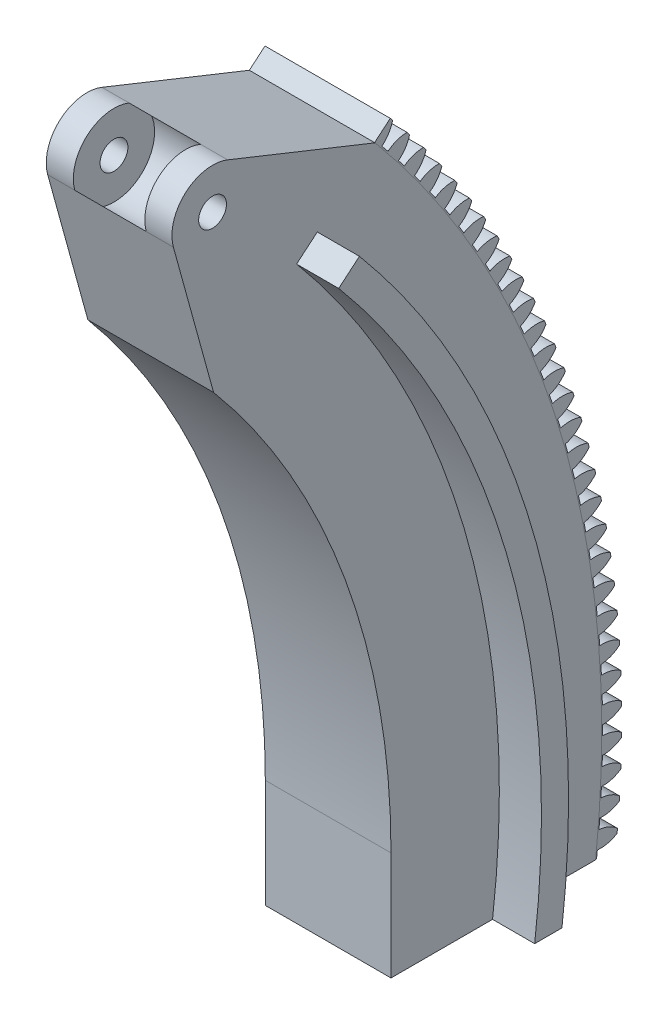
from build123d import *

# Parameters (mm, degrees)
BOSS_EXTRUDE2_DEPTH     = 6.35
BOSS_EXTRUDE3_DEPTH     = 29.464
CUT_EXTRUDE4_DEPTH      = 6.35
CIRPATTERN3_COUNT       = 230
CUT_EXTRUDE7_DEPTH      = 284.05774535
CUT_EXTRUDE7_DEPTH_BACK = 284.05774535
SKETCH15_R              = 3.2639
BOSS_EXTRUDE4_DEPTH     = 9.87425
BOSS_EXTRUDE6_START     = 23.01875
BOSS_EXTRUDE6_DEPTH     = 23.01875
SKETCH28_R              = 9.525
CUT_EXTRUDE8_DEPTH      = 16.764
SKETCH29_R              = 3.175
CUT_EXTRUDE9_DEPTH      = 12.7


with BuildPart() as part:
    # Sketch11 → Boss-Extrude2 (new body)
    with BuildSketch(Plane(origin=(6.35, 0, 0), x_dir=(0, 0, -1), z_dir=(1, 0, 0))):
        with BuildLine():
            Line((177.722316491, 149.126730219), (155.660230842, 130.614442288))
            ThreePointArc((155.660230842, 130.614442288), (190.945540544, 69.498493124), (203.2, 0))
            ThreePointArc((203.2, 0), (202.801171077, -12.724975829), (201.606249903, -25.4))
            Line((201.606249903, -25.4), (230.605384683, -25.4))
            ThreePointArc((230.605384683, -25.4), (231.65108936, -12.719129025), (232.000007424, 0))
            ThreePointArc((232.000007424, 0), (218.008694999, 79.348675791), (177.722316491, 149.126730219))
        make_face()
    extrude(amount=-BOSS_EXTRUDE2_DEPTH)

    # Sketch1 → Boss-Extrude3 (add)
    with BuildSketch(Plane(origin=(0, 0, 0), x_dir=(0, 0, -1), z_dir=(1, 0, 0))):
        with BuildLine():
            Line((177.8, 0), (177.8, -25.4))
            Line((177.8, -25.4), (225.775729431, -25.4))
            ThreePointArc((225.775729431, -25.4), (226.843652905, -12.71995034), (227.2, 0))
            ThreePointArc((227.2, 0), (213.498163443, 77.706976564), (174.045297477, 146.041344921))
            Line((174.045297477, 146.041344921), (139.503343029, 159.851365822))
            ThreePointArc((139.503343029, 159.851365822), (129.618020291, 158.107153482), (126.784391338, 148.47738561))
            Line((126.784391338, 148.47738561), (136.202701987, 114.287637002))
            ThreePointArc((136.202701987, 114.287637002), (167.077347976, 60.811181483), (177.8, 0))
        make_face()
    extrude(amount=BOSS_EXTRUDE3_DEPTH)

    # Sketch12 → Cut-Extrude4 (cut)
    with BuildSketch(Plane(origin=(6.35, 0, 0), x_dir=(0, 0, -1), z_dir=(1, 0, 0))):
        with BuildLine():
            ThreePointArc((227.497230324, 1.124058456), (230.494867292, 1.773780404), (232.972473, 3.581938572))
            ThreePointArc((232.972473, 3.581938572), (233.000007424, 0), (232.972473, -3.581938572))
            ThreePointArc((232.972473, -3.581938572), (230.494867292, -1.773780404), (227.497230324, -1.124058456))
            ThreePointArc((227.497230324, -1.124058456), (227.50000728, 0), (227.497230324, 1.124058456))
        make_face()
    cut_extrude4 = extrude(amount=-CUT_EXTRUDE4_DEPTH, mode=Mode.SUBTRACT)

    # CirPattern3: Cut-Extrude4 ×230 about axis
    cirpattern3_axis = Axis((0, 0, 0), (1, 0, 0))
    for i in range(1, CIRPATTERN3_COUNT):
        add(cut_extrude4.rotate(cirpattern3_axis, i * 360 / CIRPATTERN3_COUNT), mode=Mode.SUBTRACT)

    # Sketch15 → Cut-Extrude7 (cut, two sides: drawn at the far end of the back side and taken through both)
    with BuildSketch(Plane(origin=(6.35, 0, 0), x_dir=(0, 0, -1), z_dir=(1, 0, 0)).offset(-CUT_EXTRUDE7_DEPTH_BACK)):
        with Locations((135.967339212, 151.007028537)):
            Circle(SKETCH15_R)
    extrude(amount=CUT_EXTRUDE7_DEPTH + CUT_EXTRUDE7_DEPTH_BACK, mode=Mode.SUBTRACT)

    # Sketch23 → Boss-Extrude4 (add)
    with BuildSketch(Plane(origin=(0, 0, 0), x_dir=(0, 0, -1), z_dir=(1, 0, 0))):
        with BuildLine():
            Line((155.660230842, 130.614442288), (160.524613056, 134.69614361))
            ThreePointArc((160.524613056, 134.69614361), (196.912588686, 71.670321034), (209.55, 0))
            ThreePointArc((209.55, 0), (209.163370775, -12.723475387), (208.004909798, -25.4))
            Line((208.004909798, -25.4), (201.606249903, -25.4))
            ThreePointArc((201.606249903, -25.4), (202.801171077, -12.724975829), (203.2, 0))
            ThreePointArc((203.2, 0), (190.945540544, 69.498493124), (155.660230842, 130.614442288))
        make_face()
    boss_extrude4 = extrude(amount=-BOSS_EXTRUDE4_DEPTH)

    # Mirror2: Boss-Extrude4 across plane
    add(boss_extrude4.mirror(Plane(origin=(14.732, 0, 0), x_dir=(0, 0, 1), z_dir=(1, 0, 0))))

    # Sketch27 → Boss-Extrude6 (add)
    with BuildSketch(Plane(origin=(6.35, 0, 0), x_dir=(0, 0, -1), z_dir=(1, 0, 0)).offset(BOSS_EXTRUDE6_START)):
        with BuildLine():
            Line((177.722316491, 149.126730219), (174.045297477, 146.041344921))
            ThreePointArc((174.045297477, 146.041344921), (217.513785946, 65.632255207), (225.775729431, -25.4))
            Line((225.775729431, -25.4), (226.07762674, -25.4))
            ThreePointArc((226.07762674, -25.4), (226.171897735, -24.546404775), (226.262945845, -23.692459772))
            ThreePointArc((226.262945845, -23.692459772), (228.663101283, -23.551544215), (230.891757831, -22.649494707))
            ThreePointArc((230.891757831, -22.649494707), (230.94034564, -22.148593645), (230.987846786, -21.647588364))
            ThreePointArc((230.987846786, -21.647588364), (228.971262049, -20.338394215), (226.641640358, -19.743864063))
            ThreePointArc((226.641640358, -19.743864063), (226.736426656, -18.623805724), (226.825677683, -17.503292725))
            ThreePointArc((226.825677683, -17.503292725), (229.221088498, -17.296869983), (231.424274191, -16.33428174))
            ThreePointArc((231.424274191, -16.33428174), (231.459161859, -15.832240407), (231.492960423, -15.330124577))
            ThreePointArc((231.492960423, -15.330124577), (229.441367736, -14.07650152), (227.096375799, -13.545826347))
            ThreePointArc((227.096375799, -13.545826347), (227.160532561, -12.423596854), (227.219143699, -11.301064066))
            ThreePointArc((227.219143699, -11.301064066), (229.608022346, -11.029288179), (231.784093084, -10.006879521))
            ThreePointArc((231.784093084, -10.006879521), (231.805254577, -9.504072559), (231.825325337, -9.001220877))
            ThreePointArc((231.825325337, -9.001220877), (229.740255675, -7.804104412), (227.381643413, -7.337680228))
            ThreePointArc((227.381643413, -7.337680228), (227.415122764, -6.21411703), (227.443050275, -5.090402129))
            ThreePointArc((227.443050275, -5.090402129), (229.823614083, -4.753475906), (231.970946001, -3.672009792))
            ThreePointArc((231.970946001, -3.672009792), (231.978365527, -3.168812415), (231.984693505, -2.665600128))
            ThreePointArc((231.984693505, -2.665600128), (229.867702826, -1.525883589), (227.497230324, -1.124058456))
            ThreePointArc((227.497230324, -1.124058456), (227.50000728, 0), (227.497230324, 1.124058456))
            ThreePointArc((227.497230324, 1.124058456), (229.867702826, 1.525883589), (231.984693505, 2.665600128))
            ThreePointArc((231.984693505, 2.665600128), (231.978365527, 3.168812415), (231.970946001, 3.672009792))
            ThreePointArc((231.970946001, 3.672009792), (229.823614083, 4.753475906), (227.443050275, 5.090402129))
            ThreePointArc((227.443050275, 5.090402129), (227.415122764, 6.21411703), (227.381643413, 7.337680228))
            ThreePointArc((227.381643413, 7.337680228), (229.740255675, 7.804104412), (231.825325337, 9.001220877))
            ThreePointArc((231.825325337, 9.001220877), (231.805254577, 9.504072559), (231.784093084, 10.006879521))
            ThreePointArc((231.784093084, 10.006879521), (229.608022346, 11.029288179), (227.219143699, 11.301064066))
            ThreePointArc((227.219143699, 11.301064066), (227.160532561, 12.423596854), (227.096375799, 13.545826347))
            ThreePointArc((227.096375799, 13.545826347), (229.441367736, 14.07650152), (231.492960423, 15.330124577))
            ThreePointArc((231.492960423, 15.330124577), (231.459161859, 15.832240407), (231.424274191, 16.33428174))
            ThreePointArc((231.424274191, 16.33428174), (229.221088498, 17.296869983), (226.825677683, 17.503292725))
            ThreePointArc((226.825677683, 17.503292725), (226.736426656, 18.623805724), (226.641640358, 19.743864063))
            ThreePointArc((226.641640358, 19.743864063), (228.971262049, 20.338394215), (230.987846786, 21.647588364))
            ThreePointArc((230.987846786, 21.647588364), (230.94034564, 22.148593645), (230.891757831, 22.649494707))
            ThreePointArc((230.891757831, 22.649494707), (228.663101283, 23.551544215), (226.262945845, 23.692459772))
            ThreePointArc((226.262945845, 23.692459772), (226.143121532, 24.810116812), (226.017776432, 25.927168167))
            ThreePointArc((226.017776432, 25.927168167), (228.330289425, 26.585109638), (230.310361361, 27.94889791))
            ThreePointArc((230.310361361, 27.94889791), (230.24919308, 28.448418771), (230.186941388, 28.947805772))
            ThreePointArc((230.186941388, 28.947805772), (227.934477093, 29.788643403), (225.531368117, 29.863946617))
            ThreePointArc((225.531368117, 29.863946617), (225.381059935, 30.977913661), (225.225249571, 32.091124447))
            ThreePointArc((225.225249571, 32.091124447), (227.518928183, 32.811986256), (229.461009714, 34.22935094))
            ThreePointArc((229.461009714, 34.22935094), (229.386219944, 34.727014622), (229.310350824, 35.2245149))
            ThreePointArc((229.310350824, 35.2245149), (227.035759654, 36.003513188), (224.631490431, 36.013147865))
            ThreePointArc((224.631490431, 36.013147865), (224.450810546, 37.12259363), (224.264651187, 38.231133128))
            ThreePointArc((224.264651187, 38.231133128), (226.537783789, 39.01437734), (228.440425662, 40.484260746))
            ThreePointArc((228.440425662, 40.484260746), (228.352070214, 40.979695873), (228.262640281, 41.474938174))
            ThreePointArc((228.262640281, 41.474938174), (225.967619622, 42.191515802), (223.563984308, 42.135474753))
            ThreePointArc((223.563984308, 42.135474753), (223.353067549, 43.239571328), (223.136698117, 44.342612304))
            ThreePointArc((223.136698117, 44.342612304), (225.387588412, 45.187654434), (227.249370803, 46.70895968))
            ThreePointArc((227.249370803, 46.70895968), (227.147515611, 47.201796539), (227.044591603, 47.694411295))
            ThreePointArc((227.044591603, 47.694411295), (224.730854085, 48.348033526), (222.329646362, 48.226358571))
            ThreePointArc((222.329646362, 48.226358571), (222.088650124, 49.324282038), (221.84223208, 50.421001361))
            ThreePointArc((221.84223208, 50.421001361), (224.06920037, 51.327210806), (225.888733947, 52.898802637))
            ThreePointArc((225.888733947, 52.898802637), (225.773455019, 53.388673455), (225.657113741, 53.878293059))
            ThreePointArc((225.657113741, 53.878293059), (223.326385962, 54.468472135), (220.929397701, 54.281254073))
            ThreePointArc((220.929397701, 54.281254073), (220.658501825, 55.37218512), (220.382219056, 56.461764377))
            ThreePointArc((220.382219056, 56.461764377), (222.583603493, 57.428464891), (224.359530453, 59.049170525))
            ThreePointArc((224.359530453, 59.049170525), (224.230913815, 59.535709743), (224.101242084, 60.021968822))
            ThreePointArc((224.101242084, 60.021968822), (221.75526332, 60.54826433), (219.364283245, 60.295642869))
            ThreePointArc((219.364283245, 60.295642869), (219.063689882, 61.378767402), (218.75774856, 62.460393508))
            ThreePointArc((218.75774856, 62.460393508), (220.931906389, 63.486863702), (222.662901469, 65.15547371))
            ThreePointArc((222.662901469, 65.15547371), (222.521043099, 65.638318252), (222.378137682, 66.120853942))
            ThreePointArc((222.378137682, 66.120853942), (220.01865859, 66.58287314), (217.635470939, 66.265036796))
            ThreePointArc((217.635470939, 66.265036796), (217.305404404, 67.339546548), (216.970032835, 68.412412353))
            ThreePointArc((216.970032835, 68.412412353), (219.115341617, 69.497886237), (220.800113083, 71.213155438))
            ThreePointArc((220.800113083, 71.213155438), (220.645118841, 71.691944989), (220.489086379, 72.170397203))
            ThreePointArc((220.489086379, 72.170397203), (218.117867692, 72.567795315), (215.744250889, 72.18498127))
            ThreePointArc((215.744250889, 72.18498127), (215.384957489, 73.250074401), (215.02040594, 74.313379293))
            ThreePointArc((215.02040594, 74.313379293), (217.135264766, 75.457046844), (218.772555378, 77.21769524))
            ThreePointArc((218.772555378, 77.21769524), (218.604540927, 77.69207251), (218.435497858, 78.166084208))
            ThreePointArc((218.435497858, 78.166084208), (216.054309067, 78.498564682), (213.692034393, 78.051058605))
            ThreePointArc((213.692034393, 78.051058605), (213.303782248, 79.105940303), (212.91032276, 80.158890803))
            ThreePointArc((212.91032276, 80.158890803), (214.993153443, 81.359898575), (216.581741393, 83.164612305))
            ThreePointArc((216.581741393, 83.164612305), (216.400832112, 83.634223294), (216.218904581, 84.103440753))
            ThreePointArc((216.218904581, 84.103440753), (213.829522619, 84.370755478), (211.480352893, 83.858891315))
            ThreePointArc((211.480352893, 83.858891315), (211.06343173, 84.902774388), (210.641357917, 85.944584746))
            ThreePointArc((210.641357917, 85.944584746), (212.690606171, 87.202036501), (214.229305997, 89.049468819))
            ThreePointArc((214.229305997, 89.049468819), (214.035636886, 89.513963087), (213.840960655, 89.978036158))
            ThreePointArc((213.840960655, 89.978036158), (211.445168568, 90.179985654), (209.110856828, 89.604145378))
            ThreePointArc((209.110856828, 89.604145378), (208.66557777, 90.63625084), (208.2152046, 91.666143618))
            ThreePointArc((208.2152046, 91.666143618), (210.229341199, 92.979100999), (211.717004663, 94.867873282))
            ThreePointArc((211.717004663, 94.867873282), (211.510720247, 95.326904206), (211.30344059, 95.78548658))
            ThreePointArc((211.30344059, 95.78548658), (208.903026208, 95.921920145), (206.585314405, 95.28253347))
            ThreePointArc((206.585314405, 95.28253347), (206.112009735, 96.302091126), (205.633673294, 97.319297778))
            ThreePointArc((205.633673294, 97.319297778), (207.611195213, 98.686781007), (209.046712167, 100.615483783))
            ThreePointArc((209.046712167, 100.615483783), (208.827966381, 101.068708817), (208.608237979, 101.521458283))
            ThreePointArc((208.608237979, 101.521458283), (206.204992582, 101.592274105), (203.905610279, 100.889818164))
            ThreePointArc((203.905610279, 100.889818164), (203.404633195, 101.896067182), (202.898690434, 102.899828632))
            ThreePointArc((202.898690434, 102.899828632), (204.838121973, 104.320817242), (206.220421179, 106.28801124))
            ThreePointArc((206.220421179, 106.28801124), (205.989377261, 106.735092169), (205.757364083, 107.181670869))
            ThreePointArc((205.757364083, 107.181670869), (203.353081061, 107.186816103), (201.073744144, 106.421815095))
            ThreePointArc((201.073744144, 106.421815095), (200.545468495, 107.414004574), (200.012296968, 108.403571777))
            ThreePointArc((200.012296968, 108.403571777), (201.91219085, 109.877005372), (203.240240785, 111.881222599))
            ThreePointArc((203.240240785, 111.881222599), (202.997071148, 112.321825796), (202.752946331, 112.761900475))
            ThreePointArc((202.752946331, 112.761900475), (200.349419851, 112.701371281), (198.091829247, 111.874396079))
            ThreePointArc((198.091829247, 111.874396079), (197.53664925, 112.851785611), (196.97664683, 113.826420114))
            ThreePointArc((196.97664683, 113.826420114), (198.835585283, 115.351199164), (200.108394907, 117.390943997))
            ThreePointArc((200.108394907, 117.390943997), (199.853281013, 117.824740666), (199.597226732, 118.257982925))
            ThreePointArc((199.597226732, 118.257982925), (197.196250396, 118.131824473), (194.962090802, 117.243492197))
            ThreePointArc((194.962090802, 117.243492197), (194.380420754, 118.205352416), (193.794005336, 119.164326911))
            ThreePointArc((193.794005336, 119.164326911), (195.610601151, 120.739313568), (196.827220645, 122.813063873))
            ThreePointArc((196.827220645, 122.813063873), (196.56035287, 123.2397303), (196.292560202, 123.665816837))
            ThreePointArc((196.292560202, 123.665816837), (193.895925708, 123.47412327), (191.686864339, 122.525096826))
            ThreePointArc((191.686864339, 122.525096826), (191.079138305, 123.470709957), (190.466747493, 124.413308821))
            ThreePointArc((190.466747493, 124.413308821), (192.239645057, 126.037327771), (193.399166535, 128.143536038))
            ThreePointArc((193.399166535, 128.143536038), (193.120744025, 128.562753829), (192.841412808, 128.981366682))
            ThreePointArc((192.841412808, 128.981366682), (190.450908614, 128.724281049), (188.268593954, 127.715268637))
            ThreePointArc((188.268593954, 127.715268637), (187.635265441, 128.643929027), (186.997356225, 129.569448858))
            ThreePointArc((186.997356225, 129.569448858), (188.725232536, 131.241288196), (189.826790719, 133.378382695))
            ThreePointArc((189.826790719, 133.378382695), (189.537021244, 133.789839012), (189.246359924, 134.200665797))
            ThreePointArc((189.246359924, 134.200665797), (186.863769915, 133.878379945), (184.709830489, 132.810134528))
            ThreePointArc((184.709830489, 132.810134528), (184.05137211, 133.721149176), (183.388420522, 134.628899316))
            ThreePointArc((183.388420522, 134.628899316), (185.069986174, 136.347311455), (186.112759037, 138.513697403))
            ThreePointArc((186.112759037, 138.513697403), (185.811858834, 138.917085204), (185.510084314, 139.319819345))
            ThreePointArc((185.510084314, 139.319819345), (183.137186467, 138.932573777), (181.013229625, 137.805892519))
            ThreePointArc((181.013229625, 137.805892519), (180.330132748, 138.698581592), (179.642633506, 139.587884644))
            ThreePointArc((179.642633506, 139.587884644), (181.276633653, 141.351587239), (182.25984304, 143.545648))
            ThreePointArc((182.25984304, 143.545648), (181.948036652, 143.94066626), (181.635374127, 144.335007224))
            ThreePointArc((181.635374127, 144.335007224), (179.273939188, 143.883090915), (177.181549907, 142.698814589))
            ThreePointArc((177.181549907, 142.698814589), (176.474324282, 143.572511928), (175.762790426, 144.442704261))
            ThreePointArc((175.762790426, 144.442704261), (177.348005713, 146.250381172), (178.270917918, 148.470479455))
            ThreePointArc((178.270917918, 148.470479455), (177.996919643, 148.798857665), (177.722316491, 149.126730219))
        make_face()
    extrude(amount=-BOSS_EXTRUDE6_DEPTH)

    # Sketch28 → Cut-Extrude8 (cut)
    with BuildSketch(Plane(origin=(6.35, 0, 0), x_dir=(0, 0, -1), z_dir=(1, 0, 0))):
        with Locations((135.967339212, 151.007028537)):
            Circle(SKETCH28_R)
    extrude(amount=CUT_EXTRUDE8_DEPTH, mode=Mode.SUBTRACT)

    # Sketch29 → Cut-Extrude9 (cut)
    with BuildSketch(Plane.XZ.offset(25.4)):
        with Locations((14.7081875, -201.93881337)):
            Circle(SKETCH29_R)
    extrude(amount=-CUT_EXTRUDE9_DEPTH, mode=Mode.SUBTRACT)


solid = part.part
